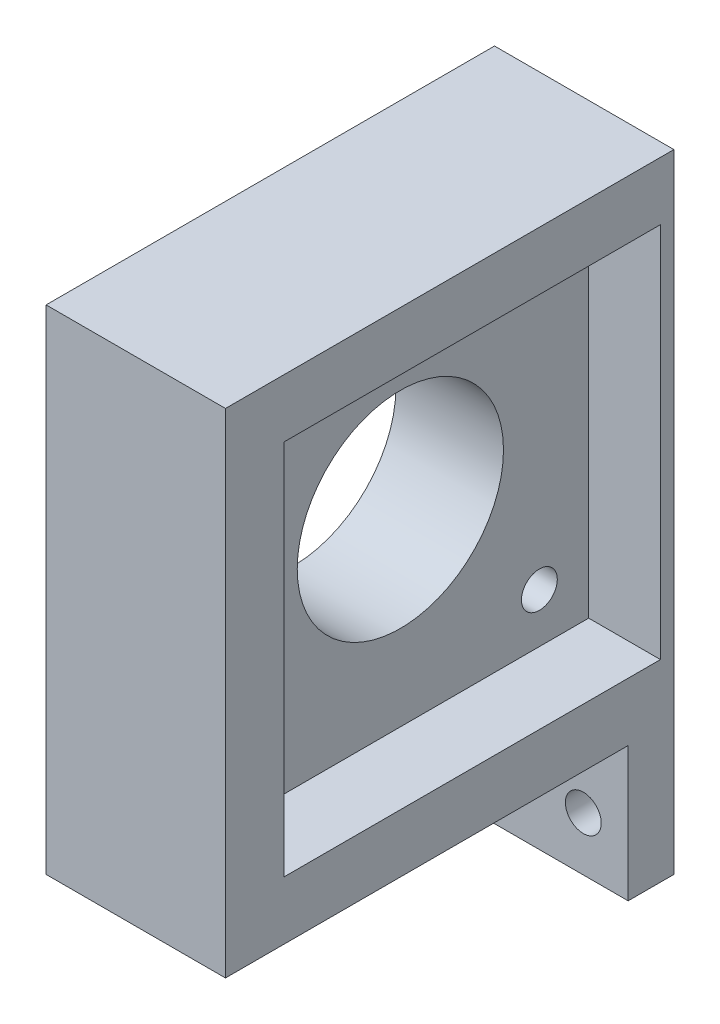
from build123d import *

# Parameters (mm, degrees)
SKETCH1_W           = 20
SKETCH1_H           = 50
BOSS_EXTRUDE1_DEPTH = 70
SKETCH2_R           = 2
SKETCH2_R_2         = 11.5
CUT_EXTRUDE2_DEPTH  = 60
SKETCH4_W           = 44.9
SKETCH4_H           = 15
CUT_EXTRUDE3_DEPTH  = 60
SKETCH8_R           = 2
CUT_EXTRUDE5_DEPTH  = 15
SKETCH9_W           = 42
SKETCH9_H           = 42
CUT_EXTRUDE6_DEPTH  = 8
SKETCH10_R          = 2
CUT_EXTRUDE7_DEPTH  = 7


with BuildPart() as part:
    # Sketch1 → Boss-Extrude1 (new body)
    with BuildSketch(Plane(origin=(0, 0, 0), x_dir=(1, 0, 0), z_dir=(0, 1, 0))):
        with Locations((-10, -25)):
            Rectangle(SKETCH1_W, SKETCH1_H)
    extrude(amount=BOSS_EXTRUDE1_DEPTH)

    # Sketch2 → Cut-Extrude2 (cut)
    with BuildSketch(Plane(origin=(0, 0, 0), x_dir=(0, 0, -1), z_dir=(1, 0, 0))):
        with Locations((-7, 58)):
            Circle(SKETCH2_R)
        with Locations((-22.5, 42.5)):
            Circle(SKETCH2_R_2)
        with Locations((-7, 27)):
            Circle(SKETCH2_R)
        with Locations((-38, 27)):
            Circle(SKETCH2_R)
        with Locations((-38, 58)):
            Circle(SKETCH2_R)
    extrude(amount=-CUT_EXTRUDE2_DEPTH, mode=Mode.SUBTRACT)

    # Sketch4 → Cut-Extrude3 (cut)
    with BuildSketch(Plane(origin=(0, 0, 0), x_dir=(0, 0, -1), z_dir=(1, 0, 0))):
        with Locations((-27.55, 7.5)):
            Rectangle(SKETCH4_W, SKETCH4_H)
    extrude(amount=-CUT_EXTRUDE3_DEPTH, mode=Mode.SUBTRACT)

    # Sketch8 → Cut-Extrude5 (cut)
    with BuildSketch(Plane(origin=(0, 0, 0), x_dir=(-1, 0, 0), z_dir=(0, 0, -1))):
        with Locations((15, 6)):
            Circle(SKETCH8_R)
    extrude(amount=-CUT_EXTRUDE5_DEPTH, mode=Mode.SUBTRACT)

    # Sketch9 → Cut-Extrude6 (cut)
    with BuildSketch(Plane(origin=(0, 0, 0), x_dir=(0, 0, -1), z_dir=(1, 0, 0))):
        with Locations((-22.5, 42.5)):
            Rectangle(SKETCH9_W, SKETCH9_H)
    extrude(amount=-CUT_EXTRUDE6_DEPTH, mode=Mode.SUBTRACT)

    # Sketch10 → Cut-Extrude7 (cut)
    with BuildSketch(Plane(origin=(0, 0, 0), x_dir=(-1, 0, 0), z_dir=(0, 0, -1))):
        with Locations((5, 6)):
            Circle(SKETCH10_R)
    extrude(amount=-CUT_EXTRUDE7_DEPTH, mode=Mode.SUBTRACT)


solid = part.part
